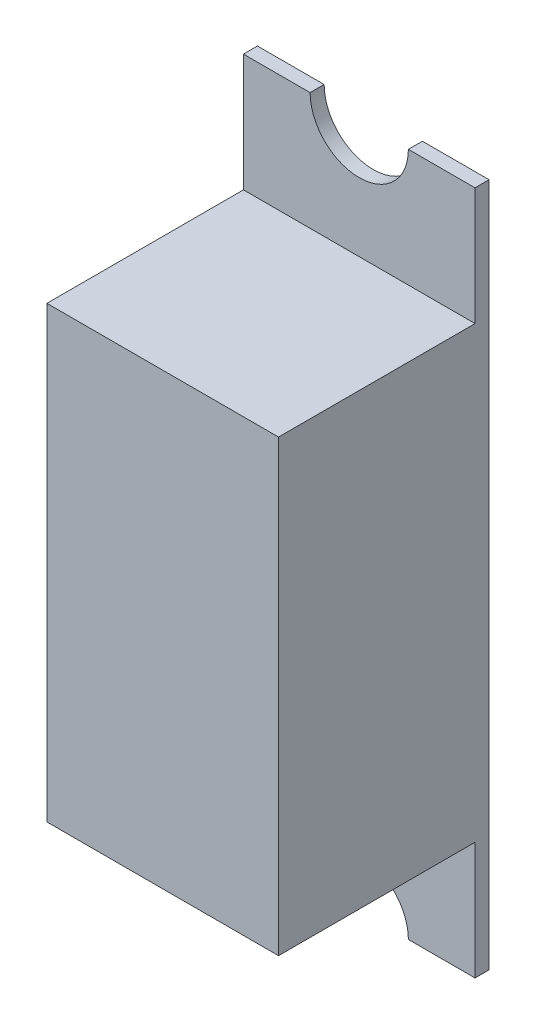
from build123d import *

# Parameters (mm, degrees)
ESQUISSE1_W        = 6.6
ESQUISSE1_H        = 12.8
BOSS_EXTRU_1_DEPTH = 5.6
BOSS_EXTRU_2_DEPTH = 0.4


with BuildPart() as part:
    # Esquisse1 → Boss.-Extru.1 (new body)
    with BuildSketch(Plane.XY):
        with Locations((-3.3, -6.4)):
            Rectangle(ESQUISSE1_W, ESQUISSE1_H)
    extrude(amount=BOSS_EXTRU_1_DEPTH)

    # Esquisse2 → Boss.-Extru.2 (add)
    with BuildSketch(Plane(origin=(0, 0, 0), x_dir=(-1, 0, 0), z_dir=(0, 0, -1))):
        with BuildLine():
            Line((1.9, 3.35), (0, 3.35))
            Line((0, 3.35), (0, -16.15))
            Line((0, -16.15), (1.9, -16.15))
            ThreePointArc((1.9, -16.15), (3.3, -14.75), (4.7, -16.15))
            Line((4.7, -16.15), (6.6, -16.15))
            Line((6.6, -16.15), (6.6, 3.35))
            Line((6.6, 3.35), (4.7, 3.35))
            ThreePointArc((4.7, 3.35), (3.3, 1.95), (1.9, 3.35))
        make_face()
    extrude(amount=BOSS_EXTRU_2_DEPTH)


solid = part.part
